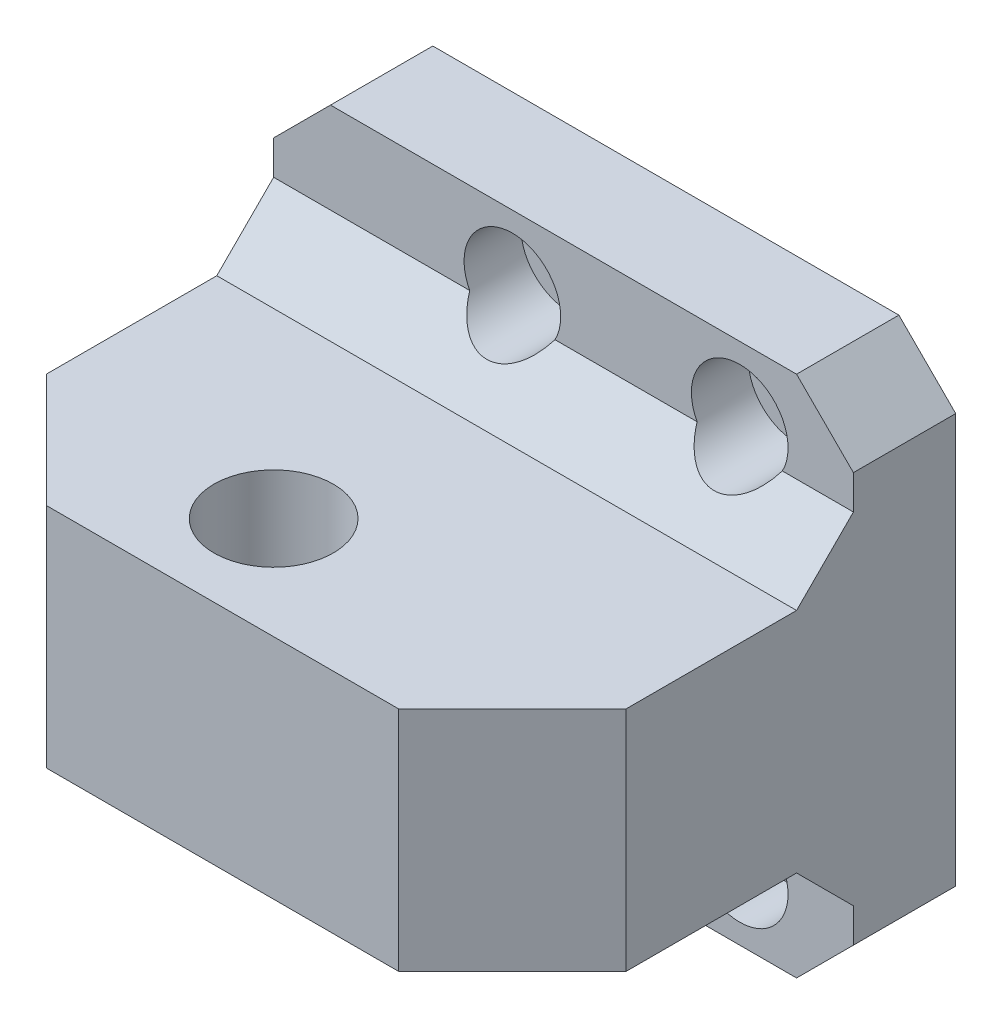
from build123d import *

# Parameters (mm, degrees)
SKETCH_1_R          = 2.75
EXTRUDE_1_DEPTH     = 9
SKETCH_6_R          = 4.25
CUT_EXTRUDE_3_DEPTH = 5
CHAMFER_2_SIZE      = 5
SKETCH_8_W          = 51
SKETCH_8_H          = 20
EXTRUDE_2_DEPTH     = 30
SKETCH_9_R          = 5.25
CUT_EXTRUDE_4_DEPTH = 60.245252974
CHAMFER_3_SIZE      = 10
CHAMFER_4_SIZE      = 5


with BuildPart() as part:
    # 草圖1 → 填料-伸長1 (new body)
    with BuildSketch(Plane.XY):
        Polygon((30, 23), (21, 23), (-21, 23), (-21, -23), (21, -23), (30, -23), align=None)
        with Locations((0, 17)):
            Circle(SKETCH_1_R, mode=Mode.SUBTRACT)
        with Locations((20, 17)):
            Circle(SKETCH_1_R, mode=Mode.SUBTRACT)
        with Locations((20, -17)):
            Circle(SKETCH_1_R, mode=Mode.SUBTRACT)
        with Locations((0, -17)):
            Circle(SKETCH_1_R, mode=Mode.SUBTRACT)
    extrude(amount=EXTRUDE_1_DEPTH)

    # 草圖6 → 除料-伸長3 (cut)
    with BuildSketch(Plane.XY.offset(9)):
        with Locations((0, 17)):
            Circle(SKETCH_6_R)
        with Locations((20, 17)):
            Circle(SKETCH_6_R)
        with Locations((20, -17)):
            Circle(SKETCH_6_R)
        with Locations((0, -17)):
            Circle(SKETCH_6_R)
    extrude(amount=-CUT_EXTRUDE_3_DEPTH, mode=Mode.SUBTRACT)

    # 導角2
    chamfer_2_edges = [part.edges().sort_by_distance(p)[0] for p in [
        (-21, 23, 4.5),
        (30, 23, 4.5),
        (30, -23, 4.5),
        (-21, -23, 4.5),
    ]]
    chamfer(chamfer_2_edges, length=CHAMFER_2_SIZE)

    # 草圖8 → 填料-伸長2 (add)
    with BuildSketch(Plane.XY.offset(9)):
        with Locations((4.5, 0)):
            Rectangle(SKETCH_8_W, SKETCH_8_H)
    extrude(amount=EXTRUDE_2_DEPTH)

    # 草圖9 → 除料-伸長4 (cut, through all)
    with BuildSketch(Plane(origin=(0, 10, 0), x_dir=(1, 0, 0), z_dir=(0, 1, 0))):
        with Locations(Location((0, -30, 0), (0, 0, 180))):
            Circle(SKETCH_9_R)
    extrude(amount=-CUT_EXTRUDE_4_DEPTH, mode=Mode.SUBTRACT)

    # 導角3
    chamfer_3_edges = [part.edges().sort_by_distance(p)[0] for p in [
        (-21, 0, 39),
        (30, 0, 39),
    ]]
    chamfer(chamfer_3_edges, length=CHAMFER_3_SIZE)

    # 導角4
    # the kernel refuses this chamfer: 5 mm, written as the material it adds along each edge
    with BuildSketch(Plane(origin=(-21, -10, 9), x_dir=(0, 0.027495876610586317, 0.9996219169112968), z_dir=(1, 0, 0))) as chamfer_4_piece_1_section:
        Polygon((CHAMFER_4_SIZE * 0.999621916911, CHAMFER_4_SIZE * 0.0274958766106), (-CHAMFER_4_SIZE * 0.0274958766106, CHAMFER_4_SIZE * 0.999621916911), (0, 0), align=None)
    chamfer_4_piece_1 = extrude(amount=51, mode=Mode.PRIVATE)
    chamfer_4_piece_1 = chamfer_4_piece_1 - Plane(origin=(0, -17, 10.693214972), x_dir=(1, 0, 0), z_dir=(0, 0, 1)) * Cylinder(4.25, 122, mode=Mode.PRIVATE)
    chamfer_4_piece_1 = chamfer_4_piece_1 - Plane(origin=(20, -17, 10.693214972), x_dir=(1, 0, 0), z_dir=(0, 0, 1)) * Cylinder(4.25, 122, mode=Mode.PRIVATE)
    add(chamfer_4_piece_1)
    with BuildSketch(Plane(origin=(30, 10, 9), x_dir=(0, -0.027495876610586317, 0.9996219169112968), z_dir=(-1, 0, 0))) as chamfer_4_piece_2_section:
        Polygon((CHAMFER_4_SIZE * 0.999621916911, CHAMFER_4_SIZE * 0.0274958766106), (-CHAMFER_4_SIZE * 0.0274958766106, CHAMFER_4_SIZE * 0.999621916911), (0, 0), align=None)
    chamfer_4_piece_2 = extrude(amount=51, mode=Mode.PRIVATE)
    chamfer_4_piece_2 = chamfer_4_piece_2 - Plane(origin=(0, 17, 10.693214972), x_dir=(1, 0, 0), z_dir=(0, 0, 1)) * Cylinder(4.25, 122, mode=Mode.PRIVATE)
    chamfer_4_piece_2 = chamfer_4_piece_2 - Plane(origin=(20, 17, 10.693214972), x_dir=(1, 0, 0), z_dir=(0, 0, 1)) * Cylinder(4.25, 122, mode=Mode.PRIVATE)
    add(chamfer_4_piece_2)


solid = part.part
